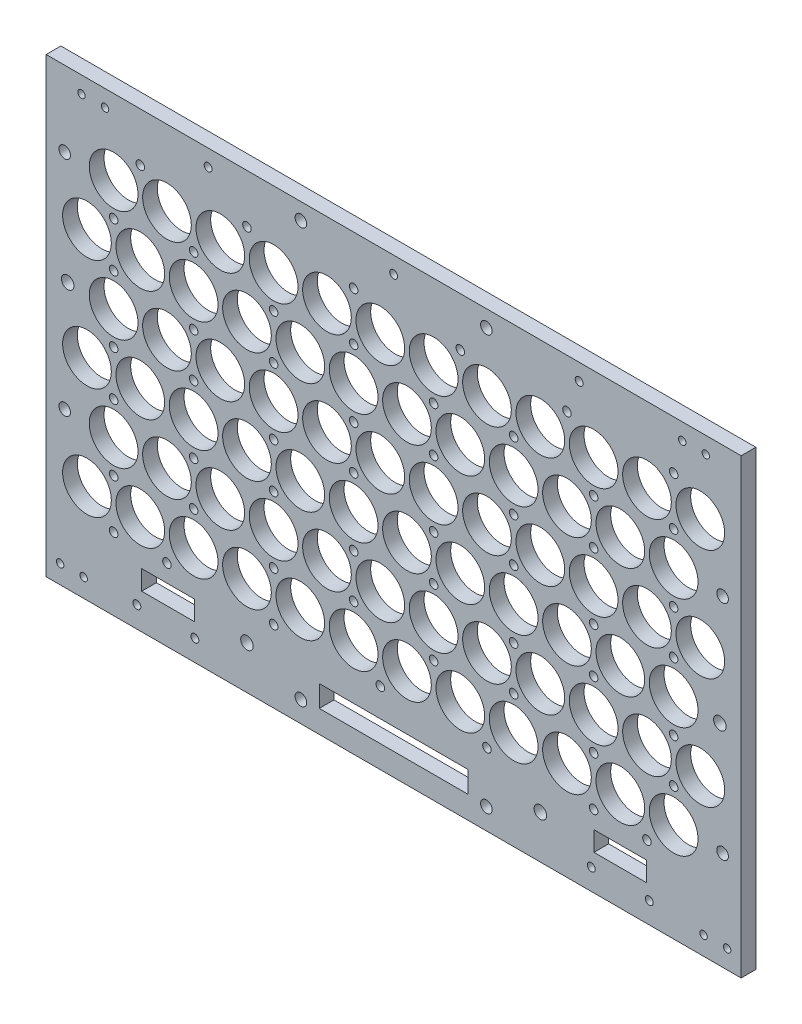
from build123d import *

# Parameters (mm, degrees)
SKETCH1_W                  = 299.700000132
SKETCH1_H                  = 194.250000104
BOSS_EXTRUDE1_DEPTH        = 6.35
SKETCH3_R                  = 10.4988
CUT_EXTRUDE1_DEPTH         = 182.719853184
SKETCH4_R                  = 10.4988
CUT_EXTRUDE2_DEPTH         = 182.719853184
LPATTERN1_COUNT            = 12
LPATTERN1_PITCH            = 23
LPATTERN2_COPY_1_SKETCH_R  = 10.4988
LPATTERN2_COPY_1_DEPTH     = 182.719853184
LPATTERN2_COPY_2_SKETCH_R  = 10.4988
LPATTERN2_COPY_2_DEPTH     = 182.719853184
LPATTERN2_COPY_3_SKETCH_R  = 10.4988
LPATTERN2_COPY_3_DEPTH     = 182.719853184
LPATTERN2_COPY_4_SKETCH_R  = 10.4988
LPATTERN2_COPY_4_DEPTH     = 182.719853184
LPATTERN2_COPY_5_SKETCH_R  = 10.4988
LPATTERN2_COPY_5_DEPTH     = 182.719853184
LPATTERN2_COPY_6_SKETCH_R  = 10.4988
LPATTERN2_COPY_6_DEPTH     = 182.719853184
LPATTERN2_COPY_7_SKETCH_R  = 10.4988
LPATTERN2_COPY_7_DEPTH     = 182.719853184
LPATTERN2_COPY_8_SKETCH_R  = 10.4988
LPATTERN2_COPY_8_DEPTH     = 182.719853184
LPATTERN2_COPY_9_SKETCH_R  = 10.4988
LPATTERN2_COPY_9_DEPTH     = 182.719853184
LPATTERN2_COPY_10_SKETCH_R = 10.4988
LPATTERN2_COPY_10_DEPTH    = 182.719853184
LPATTERN2_COPY_11_SKETCH_R = 10.4988
LPATTERN2_COPY_11_DEPTH    = 182.719853184
LPATTERN2_COPY_12_SKETCH_R = 10.4988
LPATTERN2_COPY_12_DEPTH    = 182.719853184
LPATTERN2_COPY_13_SKETCH_R = 10.4988
LPATTERN2_COPY_13_DEPTH    = 182.719853184
LPATTERN2_COPY_14_SKETCH_R = 10.4988
LPATTERN2_COPY_14_DEPTH    = 182.719853184
LPATTERN2_COPY_15_SKETCH_R = 10.4988
LPATTERN2_COPY_15_DEPTH    = 182.719853184
LPATTERN2_COPY_16_SKETCH_R = 10.4988
LPATTERN2_COPY_16_DEPTH    = 182.719853184
LPATTERN2_COPY_17_SKETCH_R = 10.4988
LPATTERN2_COPY_17_DEPTH    = 182.719853184
LPATTERN2_COPY_18_SKETCH_R = 10.4988
LPATTERN2_COPY_18_DEPTH    = 182.719853184
LPATTERN2_COPY_19_SKETCH_R = 10.4988
LPATTERN2_COPY_19_DEPTH    = 182.719853184
LPATTERN2_COPY_20_SKETCH_R = 10.4988
LPATTERN2_COPY_20_DEPTH    = 182.719853184
LPATTERN2_COPY_21_SKETCH_R = 10.4988
LPATTERN2_COPY_21_DEPTH    = 182.719853184
LPATTERN2_COPY_22_SKETCH_R = 10.4988
LPATTERN2_COPY_22_DEPTH    = 182.719853184
LPATTERN2_COPY_23_SKETCH_R = 10.4988
LPATTERN2_COPY_23_DEPTH    = 182.719853184
LPATTERN2_COPY_24_SKETCH_R = 10.4988
LPATTERN2_COPY_24_DEPTH    = 182.719853184
LPATTERN2_COPY_25_SKETCH_R = 10.4988
LPATTERN2_COPY_25_DEPTH    = 182.719853184
LPATTERN2_COPY_26_SKETCH_R = 10.4988
LPATTERN2_COPY_26_DEPTH    = 182.719853184
LPATTERN2_COPY_27_SKETCH_R = 10.4988
LPATTERN2_COPY_27_DEPTH    = 182.719853184
LPATTERN2_COPY_28_SKETCH_R = 10.4988
LPATTERN2_COPY_28_DEPTH    = 182.719853184
LPATTERN2_COPY_29_SKETCH_R = 10.4988
LPATTERN2_COPY_29_DEPTH    = 182.719853184
LPATTERN2_COPY_30_SKETCH_R = 10.4988
LPATTERN2_COPY_30_DEPTH    = 182.719853184
LPATTERN2_COPY_31_SKETCH_R = 10.4988
LPATTERN2_COPY_31_DEPTH    = 182.719853184
LPATTERN2_COPY_32_SKETCH_R = 10.4988
LPATTERN2_COPY_32_DEPTH    = 182.719853184
LPATTERN2_COPY_33_SKETCH_R = 10.4988
LPATTERN2_COPY_33_DEPTH    = 182.719853184
LPATTERN2_COPY_34_SKETCH_R = 10.4988
LPATTERN2_COPY_34_DEPTH    = 182.719853184
LPATTERN2_COPY_35_SKETCH_R = 10.4988
LPATTERN2_COPY_35_DEPTH    = 182.719853184
LPATTERN2_COPY_36_SKETCH_R = 10.4988
LPATTERN2_COPY_36_DEPTH    = 182.719853184
LPATTERN2_COPY_37_SKETCH_R = 10.4988
LPATTERN2_COPY_37_DEPTH    = 182.719853184
LPATTERN2_COPY_38_SKETCH_R = 10.4988
LPATTERN2_COPY_38_DEPTH    = 182.719853184
LPATTERN2_COPY_39_SKETCH_R = 10.4988
LPATTERN2_COPY_39_DEPTH    = 182.719853184
LPATTERN2_COPY_40_SKETCH_R = 10.4988
LPATTERN2_COPY_40_DEPTH    = 182.719853184
LPATTERN2_COPY_41_SKETCH_R = 10.4988
LPATTERN2_COPY_41_DEPTH    = 182.719853184
LPATTERN2_COPY_42_SKETCH_R = 10.4988
LPATTERN2_COPY_42_DEPTH    = 182.719853184
LPATTERN2_COPY_43_SKETCH_R = 10.4988
LPATTERN2_COPY_43_DEPTH    = 182.719853184
LPATTERN2_COPY_44_SKETCH_R = 10.4988
LPATTERN2_COPY_44_DEPTH    = 182.719853184
LPATTERN2_COPY_45_SKETCH_R = 10.4988
LPATTERN2_COPY_45_DEPTH    = 182.719853184
LPATTERN2_COPY_46_SKETCH_R = 10.4988
LPATTERN2_COPY_46_DEPTH    = 182.719853184
LPATTERN2_COPY_47_SKETCH_R = 10.4988
LPATTERN2_COPY_47_DEPTH    = 182.719853184
LPATTERN2_COPY_48_SKETCH_R = 10.4988
LPATTERN2_COPY_48_DEPTH    = 182.719853184
SKETCH5_W                  = 22.76
SKETCH5_H                  = 8.4615
CUT_EXTRUDE3_DEPTH         = 182.719853184
M3_CLEARANCE_HOLE1_D       = 3.2
M3_CLEARANCE_HOLE2_D       = 3.4
SKETCH14_R                 = 2.7
CUT_EXTRUDE4_DEPTH         = 182.719853184
SKETCH15_R                 = 2.5
CUT_EXTRUDE5_DEPTH         = 182.719853184
SKETCH18_R                 = 1.8415
CUT_EXTRUDE7_DEPTH         = 182.719853184
SKETCH19_W                 = 299.700000132
SKETCH19_H                 = 6.35
BOSS_EXTRUDE2_DEPTH        = 0.79375
SKETCH22_R                 = 1.8415
CUT_EXTRUDE8_DEPTH         = 182.719853184
LPATTERN3_COUNT            = 3
LPATTERN3_PITCH            = 48
SKETCH23_R                 = 1.8415
CUT_EXTRUDE9_DEPTH         = 182.719853184
LPATTERN4_COUNT            = 2
LPATTERN4_PITCH            = 48
LPATTERN5_COUNT            = 4
LPATTERN5_PITCH            = 69
LPATTERN5_COPY_1_SKETCH_R  = 1.8415
LPATTERN5_COPY_1_DEPTH     = 182.719853184
LPATTERN5_COPY_2_SKETCH_R  = 1.8415
LPATTERN5_COPY_2_DEPTH     = 182.719853184
LPATTERN5_COPY_3_SKETCH_R  = 1.8415
LPATTERN5_COPY_3_DEPTH     = 182.719853184
LPATTERN5_COPY_4_SKETCH_R  = 1.8415
LPATTERN5_COPY_4_DEPTH     = 182.719853184
LPATTERN5_COPY_5_SKETCH_R  = 1.8415
LPATTERN5_COPY_5_DEPTH     = 182.719853184
LPATTERN5_COPY_6_SKETCH_R  = 1.8415
LPATTERN5_COPY_6_DEPTH     = 182.719853184
LPATTERN5_COPY_7_SKETCH_R  = 1.8415
LPATTERN5_COPY_7_DEPTH     = 182.719853184
LPATTERN5_COPY_8_SKETCH_R  = 1.8415
LPATTERN5_COPY_8_DEPTH     = 182.719853184
LPATTERN5_COPY_9_SKETCH_R  = 1.8415
LPATTERN5_COPY_9_DEPTH     = 182.719853184
M3_CLEARANCE_HOLE3_D       = 3.4
SKETCH31_W                 = 64.135
SKETCH31_H                 = 9.275
CUT_EXTRUDE10_DEPTH        = 182.719853184


with BuildPart() as part:
    # Sketch1 → Boss-Extrude1 (new body)
    with BuildSketch(Plane.XY):
        with Locations((0, -5.475000052)):
            Rectangle(SKETCH1_W, SKETCH1_H)
    extrude(amount=BOSS_EXTRUDE1_DEPTH)

    # Sketch3 → Cut-Extrude1 (cut, through all)
    with BuildSketch(Plane.XY.offset(6.35)):
        with Locations((-132.25, -60)):
            Circle(SKETCH3_R)
    cut_extrude1 = extrude(amount=-CUT_EXTRUDE1_DEPTH, mode=Mode.SUBTRACT)

    # Sketch4 → Cut-Extrude2 (cut, through all)
    with BuildSketch(Plane.XY.offset(6.35)):
        with Locations((-120.75, -36)):
            Circle(SKETCH4_R)
    cut_extrude2 = extrude(amount=-CUT_EXTRUDE2_DEPTH, mode=Mode.SUBTRACT)

    # LPattern1: Cut-Extrude1, Cut-Extrude2 ×12
    with Locations(*[(i * LPATTERN1_PITCH, 0, 0) for i in range(1, LPATTERN1_COUNT)]):
        add(cut_extrude1, mode=Mode.SUBTRACT)
        add(cut_extrude2, mode=Mode.SUBTRACT)

    # LPattern2 copy 1 sketch → LPattern2 copy 1 (cut, through all)
    with BuildSketch(Plane(origin=(23, 48, 6.35), x_dir=(1, 0, 0), z_dir=(0, 0, 1))):
        with Locations((-132.25, -60)):
            Circle(LPATTERN2_COPY_1_SKETCH_R)
    extrude(amount=-LPATTERN2_COPY_1_DEPTH, mode=Mode.SUBTRACT)

    # LPattern2 copy 2 sketch → LPattern2 copy 2 (cut, through all)
    with BuildSketch(Plane(origin=(23, 96, 6.35), x_dir=(1, 0, 0), z_dir=(0, 0, 1))):
        with Locations((-132.25, -60)):
            Circle(LPATTERN2_COPY_2_SKETCH_R)
    extrude(amount=-LPATTERN2_COPY_2_DEPTH, mode=Mode.SUBTRACT)

    # LPattern2 copy 3 sketch → LPattern2 copy 3 (cut, through all)
    with BuildSketch(Plane(origin=(46, 48, 6.35), x_dir=(1, 0, 0), z_dir=(0, 0, 1))):
        with Locations((-132.25, -60)):
            Circle(LPATTERN2_COPY_3_SKETCH_R)
    extrude(amount=-LPATTERN2_COPY_3_DEPTH, mode=Mode.SUBTRACT)

    # LPattern2 copy 4 sketch → LPattern2 copy 4 (cut, through all)
    with BuildSketch(Plane(origin=(46, 96, 6.35), x_dir=(1, 0, 0), z_dir=(0, 0, 1))):
        with Locations((-132.25, -60)):
            Circle(LPATTERN2_COPY_4_SKETCH_R)
    extrude(amount=-LPATTERN2_COPY_4_DEPTH, mode=Mode.SUBTRACT)

    # LPattern2 copy 5 sketch → LPattern2 copy 5 (cut, through all)
    with BuildSketch(Plane(origin=(69, 48, 6.35), x_dir=(1, 0, 0), z_dir=(0, 0, 1))):
        with Locations((-132.25, -60)):
            Circle(LPATTERN2_COPY_5_SKETCH_R)
    extrude(amount=-LPATTERN2_COPY_5_DEPTH, mode=Mode.SUBTRACT)

    # LPattern2 copy 6 sketch → LPattern2 copy 6 (cut, through all)
    with BuildSketch(Plane(origin=(69, 96, 6.35), x_dir=(1, 0, 0), z_dir=(0, 0, 1))):
        with Locations((-132.25, -60)):
            Circle(LPATTERN2_COPY_6_SKETCH_R)
    extrude(amount=-LPATTERN2_COPY_6_DEPTH, mode=Mode.SUBTRACT)

    # LPattern2 copy 7 sketch → LPattern2 copy 7 (cut, through all)
    with BuildSketch(Plane(origin=(92, 48, 6.35), x_dir=(1, 0, 0), z_dir=(0, 0, 1))):
        with Locations((-132.25, -60)):
            Circle(LPATTERN2_COPY_7_SKETCH_R)
    extrude(amount=-LPATTERN2_COPY_7_DEPTH, mode=Mode.SUBTRACT)

    # LPattern2 copy 8 sketch → LPattern2 copy 8 (cut, through all)
    with BuildSketch(Plane(origin=(92, 96, 6.35), x_dir=(1, 0, 0), z_dir=(0, 0, 1))):
        with Locations((-132.25, -60)):
            Circle(LPATTERN2_COPY_8_SKETCH_R)
    extrude(amount=-LPATTERN2_COPY_8_DEPTH, mode=Mode.SUBTRACT)

    # LPattern2 copy 9 sketch → LPattern2 copy 9 (cut, through all)
    with BuildSketch(Plane(origin=(115, 48, 6.35), x_dir=(1, 0, 0), z_dir=(0, 0, 1))):
        with Locations((-132.25, -60)):
            Circle(LPATTERN2_COPY_9_SKETCH_R)
    extrude(amount=-LPATTERN2_COPY_9_DEPTH, mode=Mode.SUBTRACT)

    # LPattern2 copy 10 sketch → LPattern2 copy 10 (cut, through all)
    with BuildSketch(Plane(origin=(115, 96, 6.35), x_dir=(1, 0, 0), z_dir=(0, 0, 1))):
        with Locations((-132.25, -60)):
            Circle(LPATTERN2_COPY_10_SKETCH_R)
    extrude(amount=-LPATTERN2_COPY_10_DEPTH, mode=Mode.SUBTRACT)

    # LPattern2 copy 11 sketch → LPattern2 copy 11 (cut, through all)
    with BuildSketch(Plane(origin=(138, 48, 6.35), x_dir=(1, 0, 0), z_dir=(0, 0, 1))):
        with Locations((-132.25, -60)):
            Circle(LPATTERN2_COPY_11_SKETCH_R)
    extrude(amount=-LPATTERN2_COPY_11_DEPTH, mode=Mode.SUBTRACT)

    # LPattern2 copy 12 sketch → LPattern2 copy 12 (cut, through all)
    with BuildSketch(Plane(origin=(138, 96, 6.35), x_dir=(1, 0, 0), z_dir=(0, 0, 1))):
        with Locations((-132.25, -60)):
            Circle(LPATTERN2_COPY_12_SKETCH_R)
    extrude(amount=-LPATTERN2_COPY_12_DEPTH, mode=Mode.SUBTRACT)

    # LPattern2 copy 13 sketch → LPattern2 copy 13 (cut, through all)
    with BuildSketch(Plane(origin=(161, 48, 6.35), x_dir=(1, 0, 0), z_dir=(0, 0, 1))):
        with Locations((-132.25, -60)):
            Circle(LPATTERN2_COPY_13_SKETCH_R)
    extrude(amount=-LPATTERN2_COPY_13_DEPTH, mode=Mode.SUBTRACT)

    # LPattern2 copy 14 sketch → LPattern2 copy 14 (cut, through all)
    with BuildSketch(Plane(origin=(161, 96, 6.35), x_dir=(1, 0, 0), z_dir=(0, 0, 1))):
        with Locations((-132.25, -60)):
            Circle(LPATTERN2_COPY_14_SKETCH_R)
    extrude(amount=-LPATTERN2_COPY_14_DEPTH, mode=Mode.SUBTRACT)

    # LPattern2 copy 15 sketch → LPattern2 copy 15 (cut, through all)
    with BuildSketch(Plane(origin=(184, 48, 6.35), x_dir=(1, 0, 0), z_dir=(0, 0, 1))):
        with Locations((-132.25, -60)):
            Circle(LPATTERN2_COPY_15_SKETCH_R)
    extrude(amount=-LPATTERN2_COPY_15_DEPTH, mode=Mode.SUBTRACT)

    # LPattern2 copy 16 sketch → LPattern2 copy 16 (cut, through all)
    with BuildSketch(Plane(origin=(184, 96, 6.35), x_dir=(1, 0, 0), z_dir=(0, 0, 1))):
        with Locations((-132.25, -60)):
            Circle(LPATTERN2_COPY_16_SKETCH_R)
    extrude(amount=-LPATTERN2_COPY_16_DEPTH, mode=Mode.SUBTRACT)

    # LPattern2 copy 17 sketch → LPattern2 copy 17 (cut, through all)
    with BuildSketch(Plane(origin=(207, 48, 6.35), x_dir=(1, 0, 0), z_dir=(0, 0, 1))):
        with Locations((-132.25, -60)):
            Circle(LPATTERN2_COPY_17_SKETCH_R)
    extrude(amount=-LPATTERN2_COPY_17_DEPTH, mode=Mode.SUBTRACT)

    # LPattern2 copy 18 sketch → LPattern2 copy 18 (cut, through all)
    with BuildSketch(Plane(origin=(207, 96, 6.35), x_dir=(1, 0, 0), z_dir=(0, 0, 1))):
        with Locations((-132.25, -60)):
            Circle(LPATTERN2_COPY_18_SKETCH_R)
    extrude(amount=-LPATTERN2_COPY_18_DEPTH, mode=Mode.SUBTRACT)

    # LPattern2 copy 19 sketch → LPattern2 copy 19 (cut, through all)
    with BuildSketch(Plane(origin=(230, 48, 6.35), x_dir=(1, 0, 0), z_dir=(0, 0, 1))):
        with Locations((-132.25, -60)):
            Circle(LPATTERN2_COPY_19_SKETCH_R)
    extrude(amount=-LPATTERN2_COPY_19_DEPTH, mode=Mode.SUBTRACT)

    # LPattern2 copy 20 sketch → LPattern2 copy 20 (cut, through all)
    with BuildSketch(Plane(origin=(230, 96, 6.35), x_dir=(1, 0, 0), z_dir=(0, 0, 1))):
        with Locations((-132.25, -60)):
            Circle(LPATTERN2_COPY_20_SKETCH_R)
    extrude(amount=-LPATTERN2_COPY_20_DEPTH, mode=Mode.SUBTRACT)

    # LPattern2 copy 21 sketch → LPattern2 copy 21 (cut, through all)
    with BuildSketch(Plane(origin=(253, 48, 6.35), x_dir=(1, 0, 0), z_dir=(0, 0, 1))):
        with Locations((-132.25, -60)):
            Circle(LPATTERN2_COPY_21_SKETCH_R)
    extrude(amount=-LPATTERN2_COPY_21_DEPTH, mode=Mode.SUBTRACT)

    # LPattern2 copy 22 sketch → LPattern2 copy 22 (cut, through all)
    with BuildSketch(Plane(origin=(253, 96, 6.35), x_dir=(1, 0, 0), z_dir=(0, 0, 1))):
        with Locations((-132.25, -60)):
            Circle(LPATTERN2_COPY_22_SKETCH_R)
    extrude(amount=-LPATTERN2_COPY_22_DEPTH, mode=Mode.SUBTRACT)

    # LPattern2 copy 23 sketch → LPattern2 copy 23 (cut, through all)
    with BuildSketch(Plane(origin=(23, 48, 6.35), x_dir=(1, 0, 0), z_dir=(0, 0, 1))):
        with Locations((-120.75, -36)):
            Circle(LPATTERN2_COPY_23_SKETCH_R)
    extrude(amount=-LPATTERN2_COPY_23_DEPTH, mode=Mode.SUBTRACT)

    # LPattern2 copy 24 sketch → LPattern2 copy 24 (cut, through all)
    with BuildSketch(Plane(origin=(23, 96, 6.35), x_dir=(1, 0, 0), z_dir=(0, 0, 1))):
        with Locations((-120.75, -36)):
            Circle(LPATTERN2_COPY_24_SKETCH_R)
    extrude(amount=-LPATTERN2_COPY_24_DEPTH, mode=Mode.SUBTRACT)

    # LPattern2 copy 25 sketch → LPattern2 copy 25 (cut, through all)
    with BuildSketch(Plane(origin=(46, 48, 6.35), x_dir=(1, 0, 0), z_dir=(0, 0, 1))):
        with Locations((-120.75, -36)):
            Circle(LPATTERN2_COPY_25_SKETCH_R)
    extrude(amount=-LPATTERN2_COPY_25_DEPTH, mode=Mode.SUBTRACT)

    # LPattern2 copy 26 sketch → LPattern2 copy 26 (cut, through all)
    with BuildSketch(Plane(origin=(46, 96, 6.35), x_dir=(1, 0, 0), z_dir=(0, 0, 1))):
        with Locations((-120.75, -36)):
            Circle(LPATTERN2_COPY_26_SKETCH_R)
    extrude(amount=-LPATTERN2_COPY_26_DEPTH, mode=Mode.SUBTRACT)

    # LPattern2 copy 27 sketch → LPattern2 copy 27 (cut, through all)
    with BuildSketch(Plane(origin=(69, 48, 6.35), x_dir=(1, 0, 0), z_dir=(0, 0, 1))):
        with Locations((-120.75, -36)):
            Circle(LPATTERN2_COPY_27_SKETCH_R)
    extrude(amount=-LPATTERN2_COPY_27_DEPTH, mode=Mode.SUBTRACT)

    # LPattern2 copy 28 sketch → LPattern2 copy 28 (cut, through all)
    with BuildSketch(Plane(origin=(69, 96, 6.35), x_dir=(1, 0, 0), z_dir=(0, 0, 1))):
        with Locations((-120.75, -36)):
            Circle(LPATTERN2_COPY_28_SKETCH_R)
    extrude(amount=-LPATTERN2_COPY_28_DEPTH, mode=Mode.SUBTRACT)

    # LPattern2 copy 29 sketch → LPattern2 copy 29 (cut, through all)
    with BuildSketch(Plane(origin=(92, 48, 6.35), x_dir=(1, 0, 0), z_dir=(0, 0, 1))):
        with Locations((-120.75, -36)):
            Circle(LPATTERN2_COPY_29_SKETCH_R)
    extrude(amount=-LPATTERN2_COPY_29_DEPTH, mode=Mode.SUBTRACT)

    # LPattern2 copy 30 sketch → LPattern2 copy 30 (cut, through all)
    with BuildSketch(Plane(origin=(92, 96, 6.35), x_dir=(1, 0, 0), z_dir=(0, 0, 1))):
        with Locations((-120.75, -36)):
            Circle(LPATTERN2_COPY_30_SKETCH_R)
    extrude(amount=-LPATTERN2_COPY_30_DEPTH, mode=Mode.SUBTRACT)

    # LPattern2 copy 31 sketch → LPattern2 copy 31 (cut, through all)
    with BuildSketch(Plane(origin=(115, 48, 6.35), x_dir=(1, 0, 0), z_dir=(0, 0, 1))):
        with Locations((-120.75, -36)):
            Circle(LPATTERN2_COPY_31_SKETCH_R)
    extrude(amount=-LPATTERN2_COPY_31_DEPTH, mode=Mode.SUBTRACT)

    # LPattern2 copy 32 sketch → LPattern2 copy 32 (cut, through all)
    with BuildSketch(Plane(origin=(115, 96, 6.35), x_dir=(1, 0, 0), z_dir=(0, 0, 1))):
        with Locations((-120.75, -36)):
            Circle(LPATTERN2_COPY_32_SKETCH_R)
    extrude(amount=-LPATTERN2_COPY_32_DEPTH, mode=Mode.SUBTRACT)

    # LPattern2 copy 33 sketch → LPattern2 copy 33 (cut, through all)
    with BuildSketch(Plane(origin=(138, 48, 6.35), x_dir=(1, 0, 0), z_dir=(0, 0, 1))):
        with Locations((-120.75, -36)):
            Circle(LPATTERN2_COPY_33_SKETCH_R)
    extrude(amount=-LPATTERN2_COPY_33_DEPTH, mode=Mode.SUBTRACT)

    # LPattern2 copy 34 sketch → LPattern2 copy 34 (cut, through all)
    with BuildSketch(Plane(origin=(138, 96, 6.35), x_dir=(1, 0, 0), z_dir=(0, 0, 1))):
        with Locations((-120.75, -36)):
            Circle(LPATTERN2_COPY_34_SKETCH_R)
    extrude(amount=-LPATTERN2_COPY_34_DEPTH, mode=Mode.SUBTRACT)

    # LPattern2 copy 35 sketch → LPattern2 copy 35 (cut, through all)
    with BuildSketch(Plane(origin=(161, 48, 6.35), x_dir=(1, 0, 0), z_dir=(0, 0, 1))):
        with Locations((-120.75, -36)):
            Circle(LPATTERN2_COPY_35_SKETCH_R)
    extrude(amount=-LPATTERN2_COPY_35_DEPTH, mode=Mode.SUBTRACT)

    # LPattern2 copy 36 sketch → LPattern2 copy 36 (cut, through all)
    with BuildSketch(Plane(origin=(161, 96, 6.35), x_dir=(1, 0, 0), z_dir=(0, 0, 1))):
        with Locations((-120.75, -36)):
            Circle(LPATTERN2_COPY_36_SKETCH_R)
    extrude(amount=-LPATTERN2_COPY_36_DEPTH, mode=Mode.SUBTRACT)

    # LPattern2 copy 37 sketch → LPattern2 copy 37 (cut, through all)
    with BuildSketch(Plane(origin=(184, 48, 6.35), x_dir=(1, 0, 0), z_dir=(0, 0, 1))):
        with Locations((-120.75, -36)):
            Circle(LPATTERN2_COPY_37_SKETCH_R)
    extrude(amount=-LPATTERN2_COPY_37_DEPTH, mode=Mode.SUBTRACT)

    # LPattern2 copy 38 sketch → LPattern2 copy 38 (cut, through all)
    with BuildSketch(Plane(origin=(184, 96, 6.35), x_dir=(1, 0, 0), z_dir=(0, 0, 1))):
        with Locations((-120.75, -36)):
            Circle(LPATTERN2_COPY_38_SKETCH_R)
    extrude(amount=-LPATTERN2_COPY_38_DEPTH, mode=Mode.SUBTRACT)

    # LPattern2 copy 39 sketch → LPattern2 copy 39 (cut, through all)
    with BuildSketch(Plane(origin=(207, 48, 6.35), x_dir=(1, 0, 0), z_dir=(0, 0, 1))):
        with Locations((-120.75, -36)):
            Circle(LPATTERN2_COPY_39_SKETCH_R)
    extrude(amount=-LPATTERN2_COPY_39_DEPTH, mode=Mode.SUBTRACT)

    # LPattern2 copy 40 sketch → LPattern2 copy 40 (cut, through all)
    with BuildSketch(Plane(origin=(207, 96, 6.35), x_dir=(1, 0, 0), z_dir=(0, 0, 1))):
        with Locations((-120.75, -36)):
            Circle(LPATTERN2_COPY_40_SKETCH_R)
    extrude(amount=-LPATTERN2_COPY_40_DEPTH, mode=Mode.SUBTRACT)

    # LPattern2 copy 41 sketch → LPattern2 copy 41 (cut, through all)
    with BuildSketch(Plane(origin=(230, 48, 6.35), x_dir=(1, 0, 0), z_dir=(0, 0, 1))):
        with Locations((-120.75, -36)):
            Circle(LPATTERN2_COPY_41_SKETCH_R)
    extrude(amount=-LPATTERN2_COPY_41_DEPTH, mode=Mode.SUBTRACT)

    # LPattern2 copy 42 sketch → LPattern2 copy 42 (cut, through all)
    with BuildSketch(Plane(origin=(230, 96, 6.35), x_dir=(1, 0, 0), z_dir=(0, 0, 1))):
        with Locations((-120.75, -36)):
            Circle(LPATTERN2_COPY_42_SKETCH_R)
    extrude(amount=-LPATTERN2_COPY_42_DEPTH, mode=Mode.SUBTRACT)

    # LPattern2 copy 43 sketch → LPattern2 copy 43 (cut, through all)
    with BuildSketch(Plane(origin=(253, 48, 6.35), x_dir=(1, 0, 0), z_dir=(0, 0, 1))):
        with Locations((-120.75, -36)):
            Circle(LPATTERN2_COPY_43_SKETCH_R)
    extrude(amount=-LPATTERN2_COPY_43_DEPTH, mode=Mode.SUBTRACT)

    # LPattern2 copy 44 sketch → LPattern2 copy 44 (cut, through all)
    with BuildSketch(Plane(origin=(253, 96, 6.35), x_dir=(1, 0, 0), z_dir=(0, 0, 1))):
        with Locations((-120.75, -36)):
            Circle(LPATTERN2_COPY_44_SKETCH_R)
    extrude(amount=-LPATTERN2_COPY_44_DEPTH, mode=Mode.SUBTRACT)

    # LPattern2 copy 45 sketch → LPattern2 copy 45 (cut, through all)
    with BuildSketch(Plane(origin=(0, 48, 6.35), x_dir=(1, 0, 0), z_dir=(0, 0, 1))):
        with Locations((-132.25, -60)):
            Circle(LPATTERN2_COPY_45_SKETCH_R)
    extrude(amount=-LPATTERN2_COPY_45_DEPTH, mode=Mode.SUBTRACT)

    # LPattern2 copy 46 sketch → LPattern2 copy 46 (cut, through all)
    with BuildSketch(Plane(origin=(0, 96, 6.35), x_dir=(1, 0, 0), z_dir=(0, 0, 1))):
        with Locations((-132.25, -60)):
            Circle(LPATTERN2_COPY_46_SKETCH_R)
    extrude(amount=-LPATTERN2_COPY_46_DEPTH, mode=Mode.SUBTRACT)

    # LPattern2 copy 47 sketch → LPattern2 copy 47 (cut, through all)
    with BuildSketch(Plane(origin=(0, 48, 6.35), x_dir=(1, 0, 0), z_dir=(0, 0, 1))):
        with Locations((-120.75, -36)):
            Circle(LPATTERN2_COPY_47_SKETCH_R)
    extrude(amount=-LPATTERN2_COPY_47_DEPTH, mode=Mode.SUBTRACT)

    # LPattern2 copy 48 sketch → LPattern2 copy 48 (cut, through all)
    with BuildSketch(Plane(origin=(0, 96, 6.35), x_dir=(1, 0, 0), z_dir=(0, 0, 1))):
        with Locations((-120.75, -36)):
            Circle(LPATTERN2_COPY_48_SKETCH_R)
    extrude(amount=-LPATTERN2_COPY_48_DEPTH, mode=Mode.SUBTRACT)

    # Sketch5 → Cut-Extrude3 (cut, through all)
    with BuildSketch(Plane.XY.offset(6.35)):
        with Locations((97.75, -83.18075)):
            Rectangle(SKETCH5_W, SKETCH5_H)
        with Locations((-97.288, -83.18075)):
            Rectangle(SKETCH5_W, SKETCH5_H)
    extrude(amount=-CUT_EXTRUDE3_DEPTH, mode=Mode.SUBTRACT)

    # M3 Clearance Hole1 (through all)
    with Locations(Plane.XY.offset(6.35)):
        with Locations((124.450000066, 85.3), (134.610000066, 85.3), (-124.450000066, 85.3), (-134.610000066, 85.3), (-143.817500066, -94.6000001), (-133.657500066, -94.6000001), (133.657500066, -94.6000001), (143.817500066, -94.6000001)):
            Hole(M3_CLEARANCE_HOLE1_D / 2)

    # M3 Clearance Hole2 (through all)
    with Locations(Plane.XY.offset(6.35)):
        with Locations((110.25, -93.50575), (85.25, -93.50575), (-80, 85.3), (0, 85.3), (80, 85.3)):
            Hole(M3_CLEARANCE_HOLE2_D / 2)

    # Sketch14 → Cut-Extrude4 (cut, through all)
    with BuildSketch(Plane.XY.offset(6.35)):
        with Locations((140.687500033, -12)):
            Circle(SKETCH14_R)
        with Locations((-140.549400033, 12)):
            Circle(SKETCH14_R)
        with Locations((63.25, -83.95)):
            Circle(SKETCH14_R)
        with Locations((-63.25, -83.95)):
            Circle(SKETCH14_R)
    extrude(amount=-CUT_EXTRUDE4_DEPTH, mode=Mode.SUBTRACT)

    # Sketch15 → Cut-Extrude5 (cut, through all)
    with BuildSketch(Plane.XY.offset(6.35)):
        with Locations((-40, 85.3)):
            Circle(SKETCH15_R)
        with Locations((40, 85.3)):
            Circle(SKETCH15_R)
        with Locations((141.850000066, 36)):
            Circle(SKETCH15_R)
        with Locations((141.850000066, -60)):
            Circle(SKETCH15_R)
        with Locations((-141.850000066, -36)):
            Circle(SKETCH15_R)
        with Locations((-141.850000066, 60)):
            Circle(SKETCH15_R)
        with Locations((-40, -93.50575)):
            Circle(SKETCH15_R)
        with Locations((40, -93.50575)):
            Circle(SKETCH15_R)
    extrude(amount=-CUT_EXTRUDE5_DEPTH, mode=Mode.SUBTRACT)

    # Sketch18 → Cut-Extrude7 (cut, through all)
    with BuildSketch(Plane.XY.offset(6.35)):
        with Locations((109.25, -71.41)):
            Circle(SKETCH18_R)
        with Locations((86.25, -71.41)):
            Circle(SKETCH18_R)
        with Locations((120.75, 71.41)):
            Circle(SKETCH18_R)
        with Locations((74.75, 71.41)):
            Circle(SKETCH18_R)
        with Locations((28.75, 71.41)):
            Circle(SKETCH18_R)
        with Locations((-17.25, 71.41)):
            Circle(SKETCH18_R)
        with Locations((-63.25, 71.41)):
            Circle(SKETCH18_R)
        with Locations((-109.25, 71.41)):
            Circle(SKETCH18_R)
        with Locations((40.25, -71.41)):
            Circle(SKETCH18_R)
        with Locations((-5.75, -71.41)):
            Circle(SKETCH18_R)
        with Locations((-51.75, -71.41)):
            Circle(SKETCH18_R)
        with Locations((-97.75, -71.41)):
            Circle(SKETCH18_R)
        with Locations((-120.75, -71.41)):
            Circle(SKETCH18_R)
    extrude(amount=-CUT_EXTRUDE7_DEPTH, mode=Mode.SUBTRACT)

    # Sketch19 → Boss-Extrude2 (add)
    with BuildSketch(Plane(origin=(0, 91.65, 0), x_dir=(1, 0, 0), z_dir=(0, 1, 0))):
        with Locations((0, -3.175)):
            Rectangle(SKETCH19_W, SKETCH19_H)
    extrude(amount=BOSS_EXTRUDE2_DEPTH)

    # Sketch22 → Cut-Extrude8 (cut, through all)
    with BuildSketch(Plane.XY.offset(6.35)):
        with Locations((120.75, -45.467986122)):
            Circle(SKETCH22_R)
        with Locations((86.25, -50.28293229)):
            Circle(SKETCH22_R)
    cut_extrude8 = extrude(amount=-CUT_EXTRUDE8_DEPTH, mode=Mode.SUBTRACT)

    # LPattern3: Cut-Extrude8 ×3
    with Locations(*[(0, i * LPATTERN3_PITCH, 0) for i in range(1, LPATTERN3_COUNT)]):
        add(cut_extrude8, mode=Mode.SUBTRACT)

    # Sketch23 → Cut-Extrude9 (cut, through all)
    with BuildSketch(Plane.XY.offset(6.35)):
        with Locations((120.75, -26.532013878)):
            Circle(SKETCH23_R)
        with Locations((86.25, -21.71706771)):
            Circle(SKETCH23_R)
    cut_extrude9 = extrude(amount=-CUT_EXTRUDE9_DEPTH, mode=Mode.SUBTRACT)

    # LPattern4: Cut-Extrude9 ×2
    with Locations(*[(0, i * LPATTERN4_PITCH, 0) for i in range(1, LPATTERN4_COUNT)]):
        add(cut_extrude9, mode=Mode.SUBTRACT)

    # LPattern5: Cut-Extrude8, Cut-Extrude9 ×4
    with Locations(*[(-i * LPATTERN5_PITCH, 0, 0) for i in range(1, LPATTERN5_COUNT)]):
        add(cut_extrude8, mode=Mode.SUBTRACT)
        add(cut_extrude9, mode=Mode.SUBTRACT)

    # LPattern5 copy 1 sketch → LPattern5 copy 1 (cut, through all)
    with BuildSketch(Plane(origin=(-69, 48, 6.35), x_dir=(1, 0, 0), z_dir=(0, 0, 1))):
        with Locations((120.75, -45.467986122)):
            Circle(LPATTERN5_COPY_1_SKETCH_R)
        with Locations((86.25, -50.28293229)):
            Circle(LPATTERN5_COPY_1_SKETCH_R)
    extrude(amount=-LPATTERN5_COPY_1_DEPTH, mode=Mode.SUBTRACT)

    # LPattern5 copy 2 sketch → LPattern5 copy 2 (cut, through all)
    with BuildSketch(Plane(origin=(-138, 48, 6.35), x_dir=(1, 0, 0), z_dir=(0, 0, 1))):
        with Locations((120.75, -45.467986122)):
            Circle(LPATTERN5_COPY_2_SKETCH_R)
        with Locations((86.25, -50.28293229)):
            Circle(LPATTERN5_COPY_2_SKETCH_R)
    extrude(amount=-LPATTERN5_COPY_2_DEPTH, mode=Mode.SUBTRACT)

    # LPattern5 copy 3 sketch → LPattern5 copy 3 (cut, through all)
    with BuildSketch(Plane(origin=(-207, 48, 6.35), x_dir=(1, 0, 0), z_dir=(0, 0, 1))):
        with Locations((120.75, -45.467986122)):
            Circle(LPATTERN5_COPY_3_SKETCH_R)
        with Locations((86.25, -50.28293229)):
            Circle(LPATTERN5_COPY_3_SKETCH_R)
    extrude(amount=-LPATTERN5_COPY_3_DEPTH, mode=Mode.SUBTRACT)

    # LPattern5 copy 4 sketch → LPattern5 copy 4 (cut, through all)
    with BuildSketch(Plane(origin=(-69, 96, 6.35), x_dir=(1, 0, 0), z_dir=(0, 0, 1))):
        with Locations((120.75, -45.467986122)):
            Circle(LPATTERN5_COPY_4_SKETCH_R)
        with Locations((86.25, -50.28293229)):
            Circle(LPATTERN5_COPY_4_SKETCH_R)
    extrude(amount=-LPATTERN5_COPY_4_DEPTH, mode=Mode.SUBTRACT)

    # LPattern5 copy 5 sketch → LPattern5 copy 5 (cut, through all)
    with BuildSketch(Plane(origin=(-138, 96, 6.35), x_dir=(1, 0, 0), z_dir=(0, 0, 1))):
        with Locations((120.75, -45.467986122)):
            Circle(LPATTERN5_COPY_5_SKETCH_R)
        with Locations((86.25, -50.28293229)):
            Circle(LPATTERN5_COPY_5_SKETCH_R)
    extrude(amount=-LPATTERN5_COPY_5_DEPTH, mode=Mode.SUBTRACT)

    # LPattern5 copy 6 sketch → LPattern5 copy 6 (cut, through all)
    with BuildSketch(Plane(origin=(-207, 96, 6.35), x_dir=(1, 0, 0), z_dir=(0, 0, 1))):
        with Locations((120.75, -45.467986122)):
            Circle(LPATTERN5_COPY_6_SKETCH_R)
        with Locations((86.25, -50.28293229)):
            Circle(LPATTERN5_COPY_6_SKETCH_R)
    extrude(amount=-LPATTERN5_COPY_6_DEPTH, mode=Mode.SUBTRACT)

    # LPattern5 copy 7 sketch → LPattern5 copy 7 (cut, through all)
    with BuildSketch(Plane(origin=(-69, 48, 6.35), x_dir=(1, 0, 0), z_dir=(0, 0, 1))):
        with Locations((120.75, -26.532013878)):
            Circle(LPATTERN5_COPY_7_SKETCH_R)
        with Locations((86.25, -21.71706771)):
            Circle(LPATTERN5_COPY_7_SKETCH_R)
    extrude(amount=-LPATTERN5_COPY_7_DEPTH, mode=Mode.SUBTRACT)

    # LPattern5 copy 8 sketch → LPattern5 copy 8 (cut, through all)
    with BuildSketch(Plane(origin=(-138, 48, 6.35), x_dir=(1, 0, 0), z_dir=(0, 0, 1))):
        with Locations((120.75, -26.532013878)):
            Circle(LPATTERN5_COPY_8_SKETCH_R)
        with Locations((86.25, -21.71706771)):
            Circle(LPATTERN5_COPY_8_SKETCH_R)
    extrude(amount=-LPATTERN5_COPY_8_DEPTH, mode=Mode.SUBTRACT)

    # LPattern5 copy 9 sketch → LPattern5 copy 9 (cut, through all)
    with BuildSketch(Plane(origin=(-207, 48, 6.35), x_dir=(1, 0, 0), z_dir=(0, 0, 1))):
        with Locations((120.75, -26.532013878)):
            Circle(LPATTERN5_COPY_9_SKETCH_R)
        with Locations((86.25, -21.71706771)):
            Circle(LPATTERN5_COPY_9_SKETCH_R)
    extrude(amount=-LPATTERN5_COPY_9_DEPTH, mode=Mode.SUBTRACT)

    # M3 Clearance Hole3 (through all)
    with Locations(Plane.XY.offset(6.35)):
        with Locations((-85.712000066, -93.485979104), (-110.712000066, -93.485979104)):
            Hole(M3_CLEARANCE_HOLE3_D / 2)

    # Sketch31 → Cut-Extrude10 (cut, through all)
    with BuildSketch(Plane.XY.offset(6.35)):
        with Locations((0, -88.236252104)):
            Rectangle(SKETCH31_W, SKETCH31_H)
    extrude(amount=-CUT_EXTRUDE10_DEPTH, mode=Mode.SUBTRACT)


solid = part.part
